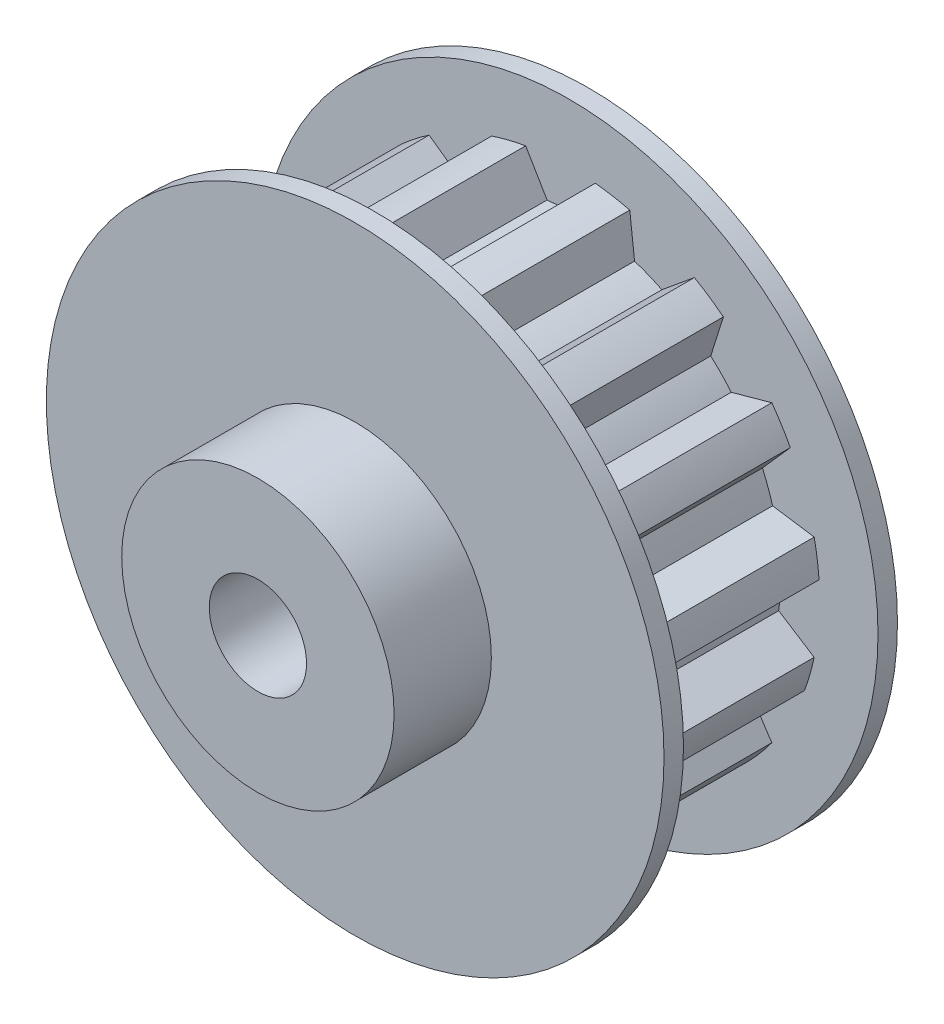
from build123d import *

# Parameters (mm, degrees)
SKETCH1_R           = 15.875
BOSS_EXTRUDE1_DEPTH = 1
BOSS_EXTRUDE2_DEPTH = 10
SKETCH3_R           = 15.875
BOSS_EXTRUDE3_DEPTH = 1
SKETCH4_R           = 7
BOSS_EXTRUDE4_DEPTH = 5
CUT_EXTRUDE1_REACH  = 30.161
SKETCH5_R           = 2.5


with BuildPart() as part:
    # Sketch1 → Boss-Extrude1 (new body)
    with BuildSketch(Plane.XY):
        Circle(SKETCH1_R)
    extrude(amount=BOSS_EXTRUDE1_DEPTH)

    # Sketch2 → Boss-Extrude2 (add)
    with BuildSketch(Plane.XY.offset(1)):
        with BuildLine():
            Line((9.934806852, -4.423260993), (12.098542493, -4.403509345))
            ThreePointArc((12.098542493, -4.403509345), (12.376244335, -3.548830956), (12.593650359, -2.676863019))
            Line((12.593650359, -2.676863019), (10.769165248, -1.513507473))
            ThreePointArc((10.769165248, -1.513507473), (10.848509047, -0.758601652), (10.875, 0))
            Line((10.875, 0), (12.843637147, 0.898114599))
            ThreePointArc((12.843637147, 0.898114599), (12.749701385, 1.791853675), (12.593650359, 2.676863019))
            Line((12.593650359, 2.676863019), (10.453720943, 2.997556245))
            ThreePointArc((10.453720943, 2.997556245), (10.219157251, 3.719469059), (9.934806852, 4.423260993))
            Line((9.934806852, 4.423260993), (11.367950258, 6.044446371))
            ThreePointArc((11.367950258, 6.044446371), (10.918619238, 6.822710527), (10.416093803, 7.567735123))
            Line((10.416093803, 7.567735123), (8.330733319, 6.990315255))
            ThreePointArc((8.330733319, 6.990315255), (7.822820329, 7.554409779), (7.276795344, 8.081699977))
            Line((7.276795344, 8.081699977), (7.926641495, 10.145638453))
            ThreePointArc((7.926641495, 10.145638453), (7.199608632, 10.673858747), (6.4375, 11.150077074))
            Line((6.4375, 11.150077074), (4.767286221, 9.774385254))
            ThreePointArc((4.767286221, 9.774385254), (4.073846703, 10.083124418), (3.360559814, 10.342739615))
            Line((3.360559814, 10.342739615), (3.114744406, 12.492557476))
            ThreePointArc((3.114744406, 12.492557476), (2.235720287, 12.67939982), (1.345803965, 12.804469403))
            Line((1.345803965, 12.804469403), (0.379532027, 10.868375244))
            ThreePointArc((0.379532027, 10.868375244), (-0.379532027, 10.868375244), (-1.136747038, 10.815425612))
            Line((-1.136747038, 10.815425612), (-2.235720287, 12.67939982))
            ThreePointArc((-2.235720287, 12.67939982), (-3.114744406, 12.492557476), (-3.978593803, 12.244852647))
            Line((-3.978593803, 12.244852647), (-4.073846703, 10.083124418))
            ThreePointArc((-4.073846703, 10.083124418), (-4.767286221, 9.774385254), (-5.4375, 9.418026266))
            Line((-5.4375, 9.418026266), (-7.199608632, 10.673858747))
            ThreePointArc((-7.199608632, 10.673858747), (-7.926641495, 10.145638453), (-8.615056557, 9.567989628))
            Line((-8.615056557, 9.567989628), (-7.822820329, 7.554409779))
            ThreePointArc((-7.822820329, 7.554409779), (-8.330733319, 6.990315255), (-8.798059814, 6.392164619))
            Line((-8.798059814, 6.392164619), (-10.918619238, 6.822710527))
            ThreePointArc((-10.918619238, 6.822710527), (-11.367950258, 6.044446371), (-11.761897767, 5.23673428))
            Line((-11.761897767, 5.23673428), (-10.219157251, 3.719469059))
            ThreePointArc((-10.219157251, 3.719469059), (-10.453720943, 2.997556245), (-10.637355158, 2.261039638))
            Line((-10.637355158, 2.261039638), (-12.749701385, 1.791853675))
            ThreePointArc((-12.749701385, 1.791853675), (-12.843637147, 0.898114599), (-12.875, 0))
            Line((-12.875, 0), (-10.848509047, -0.758601652))
            ThreePointArc((-10.848509047, -0.758601652), (-10.769165248, -1.513507473), (-10.637355158, -2.261039638))
            Line((-10.637355158, -2.261039638), (-12.376244335, -3.548830956))
            ThreePointArc((-12.376244335, -3.548830956), (-12.098542493, -4.403509345), (-11.761897767, -5.23673428))
            Line((-11.761897767, -5.23673428), (-9.602055072, -5.105503245))
            ThreePointArc((-9.602055072, -5.105503245), (-9.222523046, -5.762871999), (-8.798059814, -6.392164619))
            Line((-8.798059814, -6.392164619), (-9.862822205, -8.275890475))
            ThreePointArc((-9.862822205, -8.275890475), (-9.261499929, -8.94372652), (-8.615056557, -9.567989628))
            Line((-8.615056557, -9.567989628), (-6.695318544, -8.569616945))
            ThreePointArc((-6.695318544, -8.569616945), (-6.081222825, -9.015783602), (-5.4375, -9.418026266))
            Line((-5.4375, -9.418026266), (-5.644028515, -11.571973346))
            ThreePointArc((-5.644028515, -11.571973346), (-4.82305989, -11.937492128), (-3.978593803, -12.244852647))
            Line((-3.978593803, -12.244852647), (-2.630900615, -10.551966023))
            ThreePointArc((-2.630900615, -10.551966023), (-1.888423932, -10.709784314), (-1.136747038, -10.815425612))
            Line((-1.136747038, -10.815425612), (-0.44933102, -12.867156898))
            ThreePointArc((-0.44933102, -12.867156898), (0.44933102, -12.867156898), (1.345803965, -12.804469403))
            Line((1.345803965, -12.804469403), (1.888423932, -10.709784314))
            ThreePointArc((1.888423932, -10.709784314), (2.630900615, -10.551966023), (3.360559814, -10.342739615))
            Line((3.360559814, -10.342739615), (4.82305989, -11.937492128))
            ThreePointArc((4.82305989, -11.937492128), (5.644028515, -11.571973346), (6.4375, -11.150077074))
            Line((6.4375, -11.150077074), (6.081222825, -9.015783602))
            ThreePointArc((6.081222825, -9.015783602), (6.695318544, -8.569616945), (7.276795344, -8.081699977))
            Line((7.276795344, -8.081699977), (9.261499929, -8.94372652))
            ThreePointArc((9.261499929, -8.94372652), (9.862822205, -8.275890475), (10.416093803, -7.567735123))
            Line((10.416093803, -7.567735123), (9.222523046, -5.762871999))
            ThreePointArc((9.222523046, -5.762871999), (9.602055072, -5.105503245), (9.934806852, -4.423260993))
        make_face()
    extrude(amount=BOSS_EXTRUDE2_DEPTH)

    # Sketch3 → Boss-Extrude3 (add)
    with BuildSketch(Plane.XY.offset(11)):
        Circle(SKETCH3_R)
    extrude(amount=BOSS_EXTRUDE3_DEPTH)

    # Sketch4 → Boss-Extrude4 (add)
    with BuildSketch(Plane.XY.offset(12)):
        Circle(SKETCH4_R)
    extrude(amount=BOSS_EXTRUDE4_DEPTH)

    # Sketch5 → Cut-Extrude1 (cut, up to next)
    with BuildSketch(Plane.XY.offset(17), mode=Mode.PRIVATE) as cut_extrude1_sk1:
        Circle(SKETCH5_R)
    cut_extrude1_tool1 = extrude(cut_extrude1_sk1.sketch, amount=-CUT_EXTRUDE1_REACH, mode=Mode.PRIVATE) & part.part
    add(cut_extrude1_tool1.solids().sort_by_distance((0, 0, 17))[0], mode=Mode.SUBTRACT)


solid = part.part
